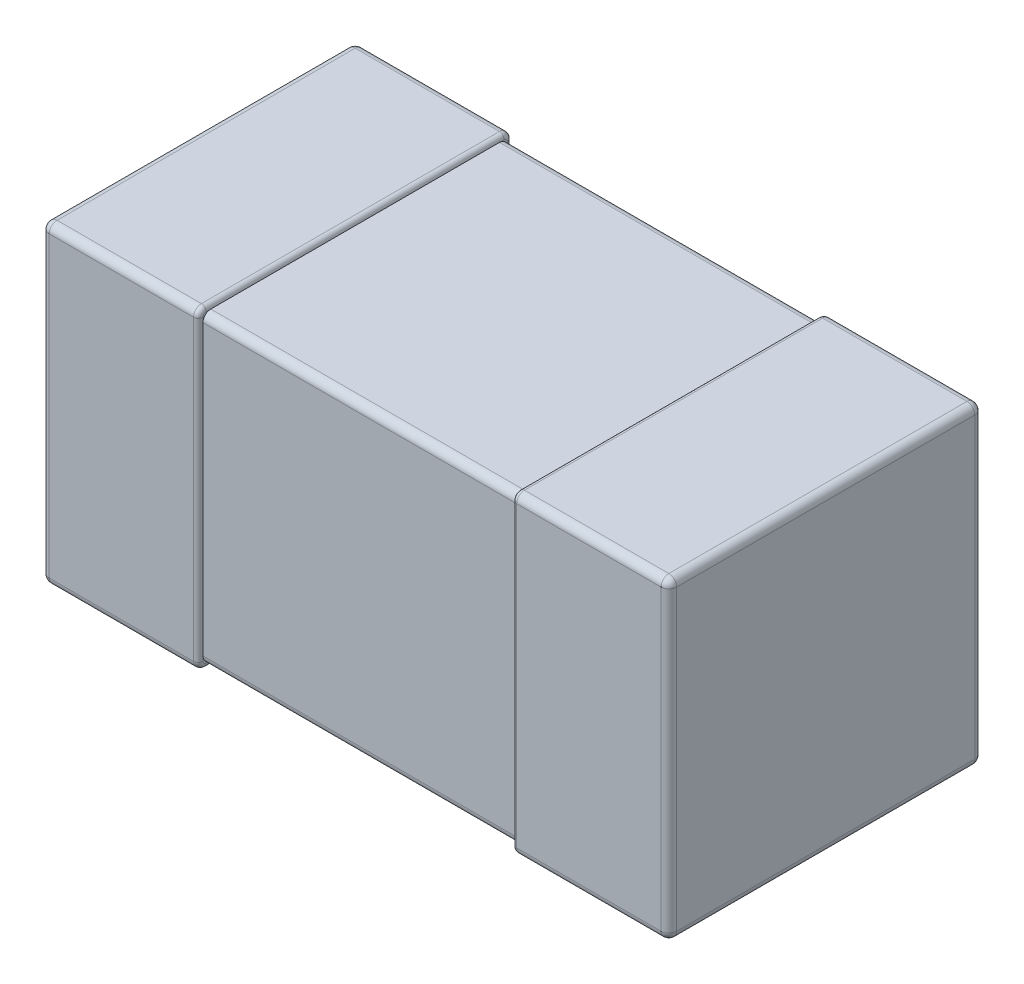
from build123d import *

# Parameters (mm, degrees)
SKETCH1_W                           = 0.4
SKETCH1_H                           = 0.2
ALL_BODY_DEPTH                      = 0.2
CUT_OUT_THE_BODY_FOR_PIN_DEPTH      = 0.1
CUT_OUT_THE_BODY_FOR_PIN_DEPTH_BACK = 0.1
SKETCH2_OUTSIDE_W                   = 2.298
SKETCH2_OUTSIDE_H                   = 2.298
SKETCH2_OUTSIDE_W_2                 = 0.194
SKETCH2_OUTSIDE_H_2                 = 0.194
BODY_FILLET_R                       = 0.005
PIN_FILLET_A_R                      = 0.005
PIN_FILLET_B_R                      = 0.003


with BuildPart() as part:
    # Sketch1 → All body (new body)
    with BuildSketch(Plane.XY):
        Rectangle(SKETCH1_W, SKETCH1_H)
    extrude(amount=ALL_BODY_DEPTH)

    # Sketch2 outside → Cut out the body for pin (cut, two sides: drawn at the far end of the back side and taken through both)
    with BuildSketch(Plane(origin=(0, 0, 0), x_dir=(0, 0, -1), z_dir=(1, 0, 0)).offset(-CUT_OUT_THE_BODY_FOR_PIN_DEPTH_BACK)):
        with Locations((-0.1, 0)):
            Rectangle(SKETCH2_OUTSIDE_W, SKETCH2_OUTSIDE_H)
        with Locations((-0.1, 0)):
            Rectangle(SKETCH2_OUTSIDE_W_2, SKETCH2_OUTSIDE_H_2, mode=Mode.SUBTRACT)
    extrude(amount=CUT_OUT_THE_BODY_FOR_PIN_DEPTH + CUT_OUT_THE_BODY_FOR_PIN_DEPTH_BACK, mode=Mode.SUBTRACT)

    # Body fillet
    body_fillet_edges = [part.edges().sort_by_distance(p)[0] for p in [
        (0, 0.097, 0.003),
        (0, 0.097, 0.197),
        (0, -0.097, 0.197),
        (0, -0.097, 0.003),
    ]]
    fillet(body_fillet_edges, radius=BODY_FILLET_R)

    # Pin fillet a
    pin_fillet_a_edges = [part.edges().sort_by_distance(p)[0] for p in [
        (0.2, 0, 0.2),
        (-0.15, 0.1, 0),
        (0.15, -0.1, 0),
        (0.15, -0.1, 0.2),
        (-0.15, 0.1, 0.2),
        (0.15, 0.1, 0.2),
        (-0.2, 0, 0.2),
        (0.15, 0.1, 0),
        (0.2, 0, 0),
        (-0.15, -0.1, 0),
        (-0.2, 0, 0),
        (-0.2, 0.1, 0.1),
        (0.2, 0.1, 0.1),
        (0.2, -0.1, 0.1),
        (-0.2, -0.1, 0.1),
        (-0.15, -0.1, 0.2),
    ]]
    fillet(pin_fillet_a_edges, radius=PIN_FILLET_A_R)

    # Pin fillet b
    pin_fillet_b_edges = [part.edges().sort_by_distance(p)[0] for p in [
        (0.1, -0.1, 0.1),
        (0.1, 0, 0.2),
        (0.1, 0.1, 0.1),
        (0.1, 0, 0),
        (-0.1, 0.1, 0.1),
        (-0.1, 0, 0.2),
        (-0.1, -0.1, 0.1),
        (-0.1, 0, 0),
        (0.1, 0.098535534, 0.001464466),
        (0.1, -0.098535534, 0.001464466),
        (0.1, -0.098535534, 0.198535534),
        (0.1, 0.098535534, 0.198535534),
        (-0.1, -0.098535534, 0.198535534),
        (-0.1, 0.098535534, 0.198535534),
        (-0.1, -0.098535534, 0.001464466),
        (-0.1, 0.098535534, 0.001464466),
    ]]
    fillet(pin_fillet_b_edges, radius=PIN_FILLET_B_R - 0.0001)  # a hair under: the kernel refuses the full size


solid = part.part
